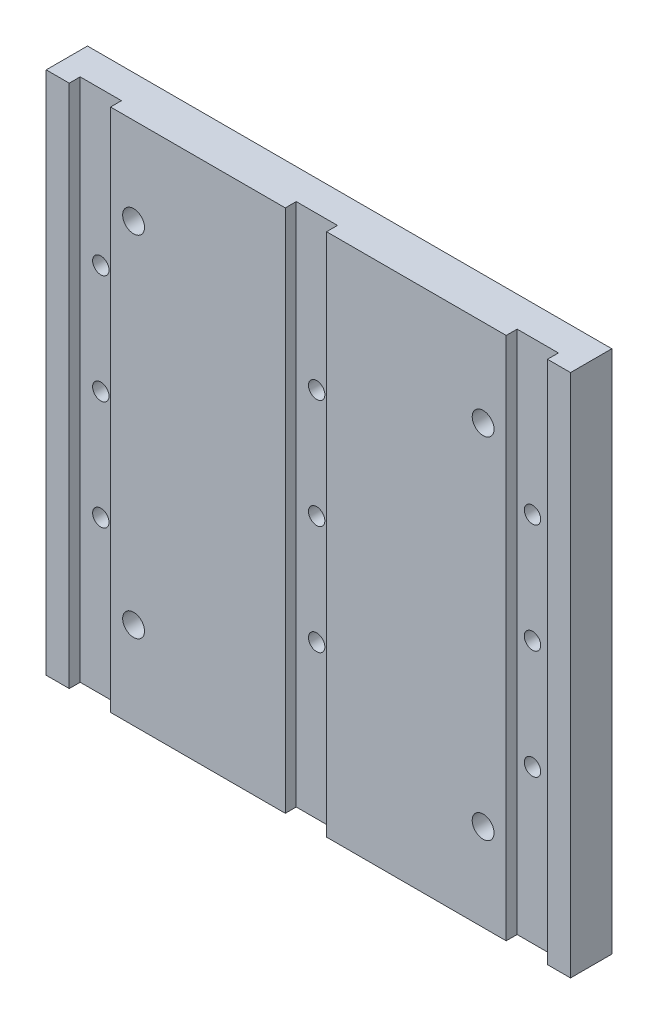
from build123d import *

# Parameters (mm, degrees)
SKETCH1_W           = 152.4
SKETCH1_H           = 152.4
SKETCH1_R           = 3.175
BOSS_EXTRUDE1_DEPTH = 12.0000014
SKETCH2_W           = 12.0000014
SKETCH2_H           = 152.4
CUT_EXTRUDE1_DEPTH  = 3.175
SKETCH3_R           = 2.38125
CUT_EXTRUDE2_DEPTH  = 109.123820917
SKETCH4_R           = 3.96875
CUT_EXTRUDE3_DEPTH  = 5.08
LPATTERN1_COUNT     = 3
LPATTERN1_PITCH     = 62.738


with BuildPart() as part:
    # Sketch1 → Boss-Extrude1 (new body)
    with BuildSketch(Plane.XY):
        Rectangle(SKETCH1_W, SKETCH1_H)
        with Locations((-50.8, 50.8)):
            Circle(SKETCH1_R, mode=Mode.SUBTRACT)
        with Locations((50.8, 50.8)):
            Circle(SKETCH1_R, mode=Mode.SUBTRACT)
        with Locations((50.8, -50.8)):
            Circle(SKETCH1_R, mode=Mode.SUBTRACT)
        with Locations((-50.8, -50.8)):
            Circle(SKETCH1_R, mode=Mode.SUBTRACT)
    extrude(amount=BOSS_EXTRUDE1_DEPTH)

    # Sketch2 → Cut-Extrude1 (cut)
    with BuildSketch(Plane.XY.offset(12.0000014)):
        with Locations((-63.5, 0)):
            Rectangle(SKETCH2_W, SKETCH2_H)
        with Locations((-0.6999986, 0)):
            Rectangle(SKETCH2_W, SKETCH2_H)
        with Locations((63.5, 0)):
            Rectangle(SKETCH2_W, SKETCH2_H)
    extrude(amount=-CUT_EXTRUDE1_DEPTH, mode=Mode.SUBTRACT)

    # Sketch3 → Cut-Extrude2 (cut, through all)
    with BuildSketch(Plane.XY.offset(8.8250014)):
        with Locations((-63.5, 0)):
            Circle(SKETCH3_R)
        with Locations((-63.5, 31.75)):
            Circle(SKETCH3_R)
        with Locations((-63.5, -31.75)):
            Circle(SKETCH3_R)
    cut_extrude2 = extrude(amount=-CUT_EXTRUDE2_DEPTH, mode=Mode.SUBTRACT)

    # Sketch4 → Cut-Extrude3 (cut)
    with BuildSketch(Plane(origin=(0, 0, 0), x_dir=(-1, 0, 0), z_dir=(0, 0, -1))):
        with Locations((63.5, 31.75)):
            Circle(SKETCH4_R)
        with Locations((63.5, 0)):
            Circle(SKETCH4_R)
        with Locations((63.5, -31.75)):
            Circle(SKETCH4_R)
    cut_extrude3 = extrude(amount=-CUT_EXTRUDE3_DEPTH, mode=Mode.SUBTRACT)

    # LPattern1: Cut-Extrude2, Cut-Extrude3 ×3
    with Locations(*[(i * LPATTERN1_PITCH, 0, 0) for i in range(1, LPATTERN1_COUNT)]):
        add(cut_extrude2, mode=Mode.SUBTRACT)
        add(cut_extrude3, mode=Mode.SUBTRACT)


solid = part.part
